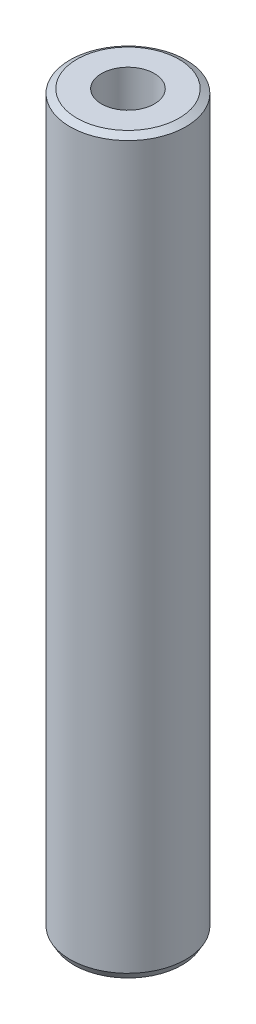
from build123d import *
from OCP.BRepFilletAPI import BRepFilletAPI_MakeChamfer

# Parameters (mm, degrees)
SKETCH1_R           = 47.5
BOSS_EXTRUDE1_DEPTH = 600
SKETCH2_R           = 21.640257206
CUT_EXTRUDE1_DEPTH  = 604.748706003
CHAMFER1_SIZE       = 3.255696289
CHAMFER1_SIZE2      = 5.639031387


with BuildPart() as part:
    # Sketch1 → Boss-Extrude1 (new body)
    with BuildSketch(Plane(origin=(0, 0, 0), x_dir=(1, 0, 0), z_dir=(0, 1, 0))):
        Circle(SKETCH1_R)
    extrude(amount=BOSS_EXTRUDE1_DEPTH)

    # Sketch2 → Cut-Extrude1 (cut, through all)
    with BuildSketch(Plane(origin=(0, 0, 0), x_dir=(1, 0, 0), z_dir=(0, 1, 0))):
        Circle(SKETCH2_R)
    extrude(amount=CUT_EXTRUDE1_DEPTH, mode=Mode.SUBTRACT)

    # Chamfer1: one chamfer whose edges measure the first distance from different faces: ONE call of the kernel's chamfer builder (chamfer() names one face for all edges)
    chamfer1_edges_1 = [part.edges().sort_by_distance(p)[0] for p in [
        (-47.5, 600, 0),
    ]]
    chamfer1_side_1 = [part.faces().sort_by_distance(p)[0] for p in [
        (-47.5, 300, 0),
    ]]
    chamfer1_edges_2 = [part.edges().sort_by_distance(p)[0] for p in [
        (-47.5, 0, 0),
    ]]
    chamfer1_side_2 = [part.faces().sort_by_distance(p)[0] for p in [
        (-46.156497116, 0, 0),
    ]]
    chamfer1 = BRepFilletAPI_MakeChamfer(part.part.solid().wrapped)
    for e in chamfer1_edges_1:
        chamfer1.Add(CHAMFER1_SIZE, CHAMFER1_SIZE2, e.wrapped, chamfer1_side_1[0].wrapped)  # the first distance lies on this face
    for e in chamfer1_edges_2:
        chamfer1.Add(CHAMFER1_SIZE, CHAMFER1_SIZE2, e.wrapped, chamfer1_side_2[0].wrapped)  # the first distance lies on this face
    add(Compound.cast(chamfer1.Shape()), mode=Mode.REPLACE)


solid = part.part
